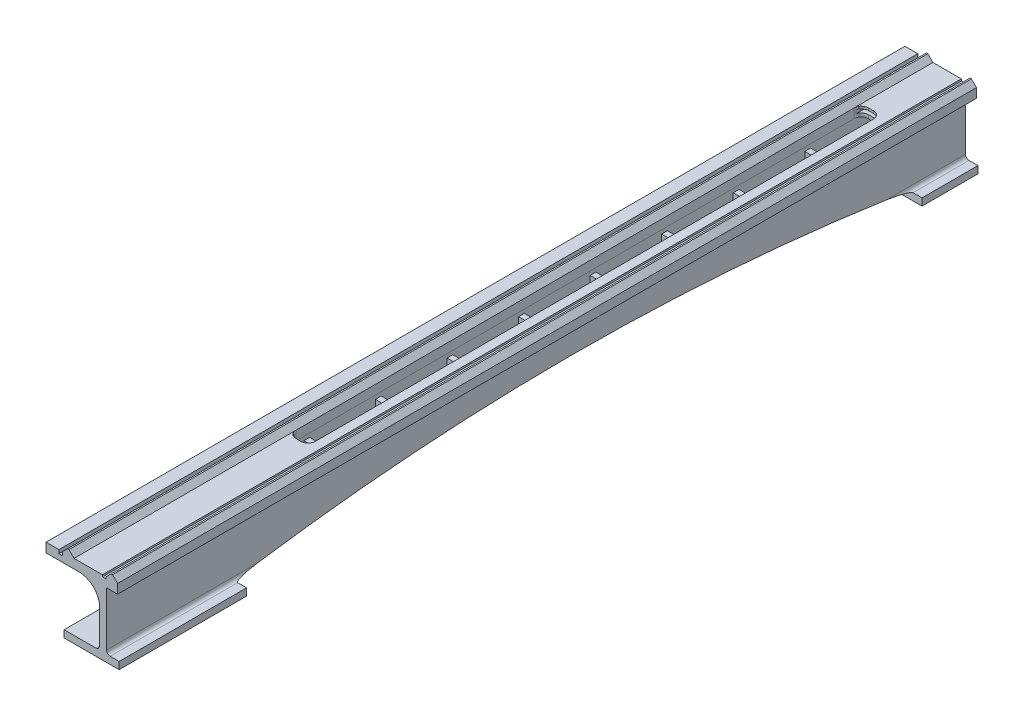
from build123d import *

# Parameters (mm, degrees)
BOSS_EXTRUDE1_DEPTH     = 1200
CUT_EXTRUDE1_DEPTH      = 800
CUT_EXTRUDE2_START      = -300
SKETCH3_W               = 32.854587933
SKETCH3_H               = 4.856765172
CUT_EXTRUDE2_DEPTH      = 900
SKETCH5_W               = 6.380456207
SKETCH5_H               = 87.231311729
BOSS_EXTRUDE2_DEPTH     = 1100
SKETCH6_W               = 8.096006647
SKETCH6_H               = 64.029540506
BOSS_EXTRUDE3_DEPTH     = 50
LPATTERN1_COUNT         = 10
LPATTERN1_PITCH         = 100
CUT_EXTRUDE3_DEPTH      = 10
CUT_EXTRUDE3_DEPTH_BACK = 100


with BuildPart() as part:
    # Sketch1 → Boss-Extrude1 (new body)
    with BuildSketch(Plane.XY):
        with BuildLine():
            Line((-33.312849815, 35.465206841), (-40.383917627, 42.536274653))
            Line((-40.383917627, 42.536274653), (-42.383917627, 42.536274653))
            Line((-42.383917627, 42.536274653), (-49.454985438, 35.465206841))
            Line((-49.454985438, 35.465206841), (-49.454985438, 32.891034548))
            Line((-49.454985438, 32.891034548), (-54.454985438, 32.891034548))
            Line((-54.454985438, 32.891034548), (-54.454985438, 35.465206841))
            Line((-54.454985438, 35.465206841), (-94.170714191, 35.465206841))
            Line((-94.170714191, 35.465206841), (-101.241782003, 42.536274653))
            Line((-101.241782003, 42.536274653), (-103.241782003, 42.536274653))
            Line((-103.241782003, 42.536274653), (-110.312849815, 35.465206841))
            Line((-110.312849815, 35.465206841), (-110.312849815, 30.48184999))
            Line((-110.312849815, 30.48184999), (-115.312849815, 30.48184999))
            Line((-115.312849815, 30.48184999), (-115.312849815, 35.465206841))
            Line((-115.312849815, 35.465206841), (-133.312849815, 35.465206841))
            Line((-133.312849815, 35.465206841), (-133.312849815, 22.536274653))
            Line((-133.312849815, 22.536274653), (-87.349569261, 22.536274653))
            ThreePointArc((-87.349569261, 22.536274653), (-68.862935324, 15.951815624), (-58.701074529, -0.836493409))
            Line((-58.701074529, -0.836493409), (-58.701074529, -52.793826888))
            ThreePointArc((-58.701074529, -52.793826888), (-60.165540623, -56.329360794), (-63.701074529, -57.793826888))
            Line((-63.701074529, -57.793826888), (-108.009983562, -57.793826888))
            Line((-108.009983562, -57.793826888), (-108.009983562, -67.793826888))
            Line((-108.009983562, -67.793826888), (-31.195424592, -67.793826888))
            Line((-31.195424592, -67.793826888), (-31.195424592, -57.793826888))
            Line((-31.195424592, -57.793826888), (-43.701074529, -57.793826888))
            ThreePointArc((-43.701074529, -57.793826888), (-47.236608435, -56.329360794), (-48.701074529, -52.793826888))
            Line((-48.701074529, -52.793826888), (-48.701074529, 22.536274653))
            Line((-48.701074529, 22.536274653), (-33.312849815, 22.536274653))
            Line((-33.312849815, 22.536274653), (-33.312849815, 35.465206841))
        make_face()
    extrude(amount=BOSS_EXTRUDE1_DEPTH)

    # Sketch2 → Cut-Extrude1 (cut)
    with BuildSketch(Plane(origin=(0, 20.764722339, 0), x_dir=(1, 0, 0), z_dir=(0, 1, 0))):
        with BuildLine():
            Line((-84.170689991, -100), (-77.170689991, -100))
            ThreePointArc((-77.170689991, -100), (-70.099622179, -102.928932188), (-67.170689991, -110))
            Line((-67.170689991, -110), (-67.170689991, -890))
            ThreePointArc((-67.170689991, -890), (-70.099622179, -897.071067812), (-77.170689991, -900))
            Line((-77.170689991, -900), (-84.170689991, -900))
            ThreePointArc((-84.170689991, -900), (-91.241757803, -897.071067812), (-94.170689991, -890))
            Line((-94.170689991, -890), (-94.170689991, -110))
            ThreePointArc((-94.170689991, -110), (-91.241757803, -102.928932188), (-84.170689991, -100))
        make_face()
    extrude(amount=CUT_EXTRUDE1_DEPTH, mode=Mode.SUBTRACT)

    # Sketch3 → Cut-Extrude2 (cut)
    with BuildSketch(Plane.XY.offset(1200).offset(CUT_EXTRUDE2_START)):
        with Locations((-77.540218065, 29.748880781)):
            Rectangle(SKETCH3_W, SKETCH3_H)
    extrude(amount=-CUT_EXTRUDE2_DEPTH, mode=Mode.SUBTRACT)

    # Sketch5 → Boss-Extrude2 (add)
    with BuildSketch(Plane(origin=(0, 0, 0), x_dir=(-1, 0, 0), z_dir=(0, 0, -1))):
        with Locations((98.110047032, -15.819004222)):
            Rectangle(SKETCH5_W, SKETCH5_H)
    extrude(amount=-BOSS_EXTRUDE2_DEPTH)

    # Sketch6 → Boss-Extrude3 (add)
    with BuildSketch(Plane.ZY.offset(101.300275135)):
        with Locations((74.203555632, -15.430068515)):
            Rectangle(SKETCH6_W, SKETCH6_H)
    boss_extrude3 = extrude(amount=-BOSS_EXTRUDE3_DEPTH)

    # LPattern1: Boss-Extrude3 ×10
    with Locations(*[(0, 0, i * LPATTERN1_PITCH) for i in range(1, LPATTERN1_COUNT)]):
        add(boss_extrude3)

    # Sketch4 → Cut-Extrude3 (cut, two sides: drawn at the far end of the back side and taken through both)
    with BuildSketch(Plane(origin=(-33.312849815, 0, 0), x_dir=(0, 0, -1), z_dir=(1, 0, 0)).offset(-CUT_EXTRUDE3_DEPTH_BACK)):
        with BuildLine():
            Line((-1021.794598087, -57.793826888), (-1021.794598087, -67.793826888))
            Line((-1021.794598087, -67.793826888), (-1021.794598087, -177.956634241))
            Line((-1021.794598087, -177.956634241), (-78.251558955, -177.956634241))
            Line((-78.251558955, -177.956634241), (-78.251558955, -57.793826888))
            ThreePointArc((-78.251558955, -57.793826888), (-550.023078521, -20.693161814), (-1021.794598087, -57.793826888))
        make_face()
    extrude(amount=CUT_EXTRUDE3_DEPTH + CUT_EXTRUDE3_DEPTH_BACK, mode=Mode.SUBTRACT)


solid = part.part
